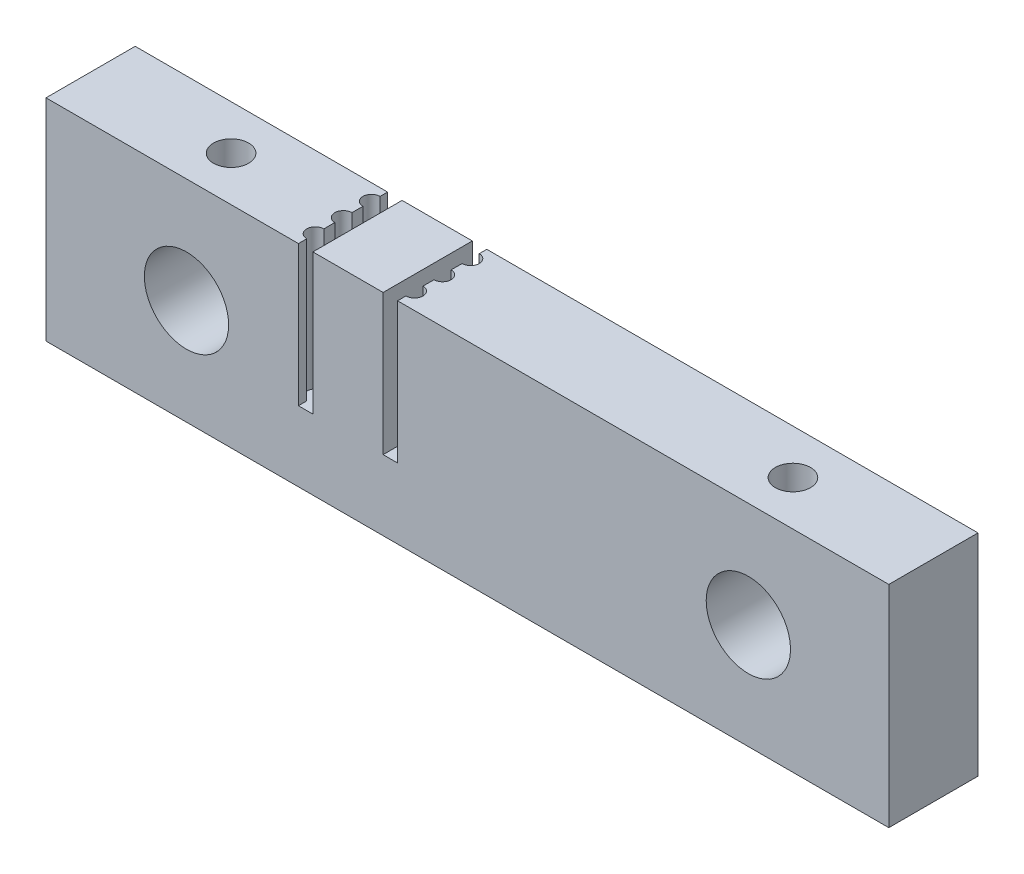
from build123d import *

# Parameters (mm, degrees)
SKETCH1_W             = 60
SKETCH1_H             = 15
SKETCH1_R             = 3
BOSS_EXTRUDE1_DEPTH   = 6.35
M3_TAPPED_HOLE1_D     = 2.5
M3_TAPPED_HOLE1_DEPTH = 8.5
M3_TAPPED_HOLE1_TIP   = 0.751075774
CUT_EXTRUDE1_DEPTH    = 10


with BuildPart() as part:
    # Sketch1 → Boss-Extrude1 (new body)
    with BuildSketch(Plane.XY):
        with Locations((30, 7.5)):
            Rectangle(SKETCH1_W, SKETCH1_H)
        with Locations((10, 7.5)):
            Circle(SKETCH1_R, mode=Mode.SUBTRACT)
        with Locations((50, 7.5)):
            Circle(SKETCH1_R, mode=Mode.SUBTRACT)
    extrude(amount=BOSS_EXTRUDE1_DEPTH)

    # M3 Tapped Hole1
    with Locations(Plane(origin=(0, 15, 0), x_dir=(-1, 0, 0), z_dir=(0, 1, 0))):
        with Locations((-10, 3.175), (-50, 3.175)):
            Hole(M3_TAPPED_HOLE1_D / 2, depth=M3_TAPPED_HOLE1_DEPTH)
            with Locations((0, 0, -(M3_TAPPED_HOLE1_DEPTH + M3_TAPPED_HOLE1_TIP / 2))):  # 118° drill point
                Cone(0, M3_TAPPED_HOLE1_D / 2, M3_TAPPED_HOLE1_TIP, mode=Mode.SUBTRACT)

    # Sketch5 → Cut-Extrude1 (cut)
    with BuildSketch(Plane(origin=(0, 15, 0), x_dir=(1, 0, 0), z_dir=(0, 1, 0))):
        with BuildLine():
            Line((19, -6.35), (19, 0))
            Line((19, 0), (17.97, 0))
            Line((17.97, 0), (17.97, -0.53745462))
            ThreePointArc((17.97, -0.53745462), (17.36, -1.14745462), (17.97, -1.75745462))
            Line((17.97, -1.75745462), (17.97, -2.53745462))
            ThreePointArc((17.97, -2.53745462), (17.36, -3.14745462), (17.97, -3.75745462))
            Line((17.97, -3.75745462), (17.97, -4.53745462))
            ThreePointArc((17.97, -4.53745462), (17.36, -5.14745462), (17.97, -5.75745462))
            Line((17.97, -5.75745462), (17.97, -6.35))
            Line((17.97, -6.35), (19, -6.35))
        make_face()
        with BuildLine():
            Line((25.03, -6.35), (24, -6.35))
            Line((24, -6.35), (24, 0))
            Line((24, 0), (25.03, 0))
            Line((25.03, 0), (25.03, -0.53745462))
            ThreePointArc((25.03, -0.53745462), (25.64, -1.14745462), (25.03, -1.75745462))
            Line((25.03, -1.75745462), (25.03, -2.53745462))
            ThreePointArc((25.03, -2.53745462), (25.64, -3.14745462), (25.03, -3.75745462))
            Line((25.03, -3.75745462), (25.03, -4.53745462))
            ThreePointArc((25.03, -4.53745462), (25.64, -5.14745462), (25.03, -5.75745462))
            Line((25.03, -5.75745462), (25.03, -6.35))
        make_face()
    extrude(amount=-CUT_EXTRUDE1_DEPTH, mode=Mode.SUBTRACT)


solid = part.part
